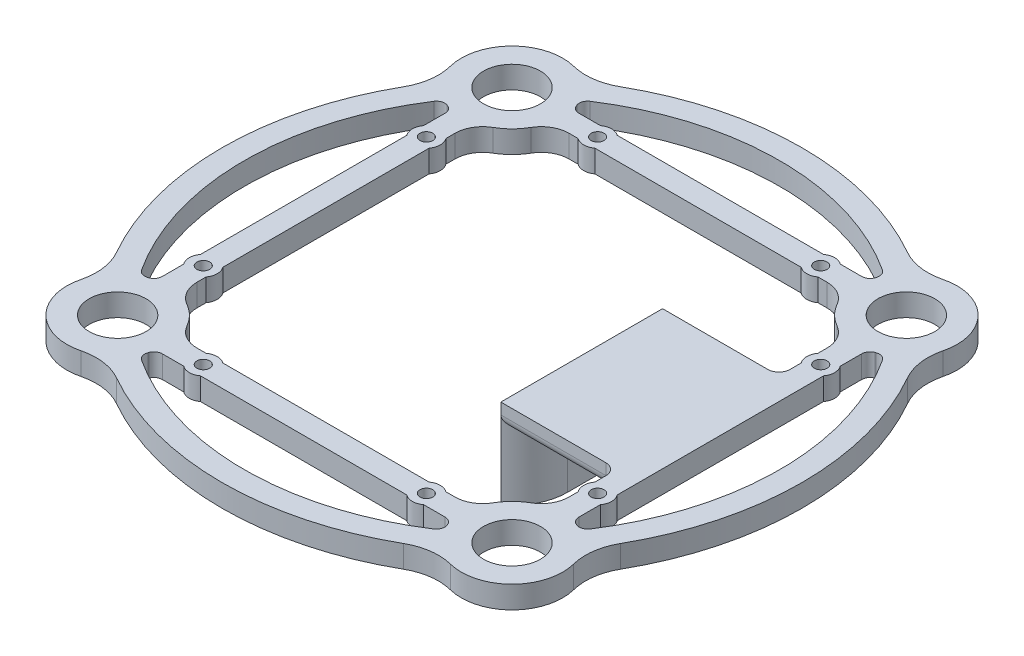
from build123d import *

# Parameters (mm, degrees)
SKETCH1_R           = 5.1
BOSS_EXTRUDE1_DEPTH = 4
BOSS_EXTRUDE2_START = -4
BOSS_EXTRUDE2_DEPTH = 4
SKETCH3_R           = 2.5
BOSS_EXTRUDE3_DEPTH = 4
SKETCH4_R           = 1.15
CUT_EXTRUDE1_DEPTH  = 4
FILLET1_R           = 10
FILLET2_R           = 1.5
FILLET3_R           = 5
SKETCH5_W           = 20.86
SKETCH5_H           = 29
BOSS_EXTRUDE4_DEPTH = 4
SKETCH6_W           = 4
SKETCH6_H           = 29
BOSS_EXTRUDE5_DEPTH = 12
FILLET4_R           = 10
FILLET5_R           = 2


with BuildPart() as part:
    # Sketch1 → Boss-Extrude1 (new body)
    with BuildSketch(Plane(origin=(0, 0, 0), x_dir=(1, 0, 0), z_dir=(0, 1, 0))):
        with BuildLine():
            ThreePointArc((-42.589636172, 29.834927363), (-52, 0), (-42.589636172, -29.834927363))
            ThreePointArc((-42.589636172, -29.834927363), (-41.790010768, -41.790010768), (-29.834927363, -42.589636172))
            ThreePointArc((-29.834927363, -42.589636172), (0, -52), (29.834927363, -42.589636172))
            ThreePointArc((29.834927363, -42.589636172), (41.790010768, -41.790010768), (42.589636172, -29.834927363))
            ThreePointArc((42.589636172, -29.834927363), (52, 0), (42.589636172, 29.834927363))
            ThreePointArc((42.589636172, 29.834927363), (41.790010768, 41.790010768), (29.834927363, 42.589636172))
            ThreePointArc((29.834927363, 42.589636172), (0, 52), (-29.834927363, 42.589636172))
            ThreePointArc((-29.834927363, 42.589636172), (-41.790010768, 41.790010768), (-42.589636172, 29.834927363))
        make_face()
        with Locations(Location((-35.355339059, -35.355339059, 0), (0, 0, 270))):
            Circle(SKETCH1_R, mode=Mode.SUBTRACT)
        with Locations(Location((35.355339059, -35.355339059, 0), (0, 0, 270))):
            Circle(SKETCH1_R, mode=Mode.SUBTRACT)
        with BuildLine():
            ThreePointArc((-27.258640426, -39.509068859), (-28.920667351, -28.920667351), (-39.509068859, -27.258640426))
            ThreePointArc((-39.509068859, -27.258640426), (-48, 0), (-39.509068859, 27.258640426))
            ThreePointArc((-39.509068859, 27.258640426), (-28.920667351, 28.920667351), (-27.258640426, 39.509068859))
            ThreePointArc((-27.258640426, 39.509068859), (0, 48), (27.258640426, 39.509068859))
            ThreePointArc((27.258640426, 39.509068859), (28.920667351, 28.920667351), (39.509068859, 27.258640426))
            ThreePointArc((39.509068859, 27.258640426), (48, 0), (39.509068859, -27.258640426))
            ThreePointArc((39.509068859, -27.258640426), (28.920667351, -28.920667351), (27.258640426, -39.509068859))
            ThreePointArc((27.258640426, -39.509068859), (0, -48), (-27.258640426, -39.509068859))
        make_face(mode=Mode.SUBTRACT)
        with Locations(Location((-35.355339059, 35.355339059, 0), (0, 0, 270))):
            Circle(SKETCH1_R, mode=Mode.SUBTRACT)
        with Locations(Location((35.355339059, 35.355339059, 0), (0, 0, 270))):
            Circle(SKETCH1_R, mode=Mode.SUBTRACT)
    extrude(amount=BOSS_EXTRUDE1_DEPTH)

    # Sketch2 → Boss-Extrude2 (add)
    with BuildSketch(Plane(origin=(0, 4, 0), x_dir=(1, 0, 0), z_dir=(0, 1, 0)).offset(BOSS_EXTRUDE2_START)):
        with BuildLine():
            ThreePointArc((-26.255339059, 35.355339059), (-26.311135203, 34.349169788), (-26.477839411, 33.355339059))
            Line((-26.477839411, 33.355339059), (26.477839411, 33.355339059))
            ThreePointArc((26.477839411, 33.355339059), (26.255339059, 35.355339059), (26.477839411, 37.355339059))
            Line((26.477839411, 37.355339059), (-26.477839411, 37.355339059))
            ThreePointArc((-26.477839411, 37.355339059), (-26.311135203, 36.36150833), (-26.255339059, 35.355339059))
        make_face()
        with BuildLine():
            Line((-33.355339059, -26.477839411), (-33.355339059, 26.477839411))
            ThreePointArc((-33.355339059, 26.477839411), (-35.355339059, 26.255339059), (-37.355339059, 26.477839411))
            Line((-37.355339059, 26.477839411), (-37.355339059, -26.477839411))
            ThreePointArc((-37.355339059, -26.477839411), (-35.355339059, -26.255339059), (-33.355339059, -26.477839411))
        make_face()
        with BuildLine():
            ThreePointArc((37.355339059, 26.477839411), (35.355339059, 26.255339059), (33.355339059, 26.477839411))
            Line((33.355339059, 26.477839411), (33.355339059, -26.477839411))
            ThreePointArc((33.355339059, -26.477839411), (35.355339059, -26.255339059), (37.355339059, -26.477839411))
            Line((37.355339059, -26.477839411), (37.355339059, 26.477839411))
        make_face()
        with BuildLine():
            Line((26.477839411, -33.355339059), (-26.477839411, -33.355339059))
            ThreePointArc((-26.477839411, -33.355339059), (-26.311135203, -34.349169788), (-26.255339059, -35.355339059))
            ThreePointArc((-26.255339059, -35.355339059), (-26.311135203, -36.36150833), (-26.477839411, -37.355339059))
            Line((-26.477839411, -37.355339059), (26.477839411, -37.355339059))
            ThreePointArc((26.477839411, -37.355339059), (26.255339059, -35.355339059), (26.477839411, -33.355339059))
        make_face()
    extrude(amount=BOSS_EXTRUDE2_DEPTH)

    # Sketch3 → Boss-Extrude3 (add)
    with BuildSketch(Plane(origin=(0, 4, 0), x_dir=(1, 0, 0), z_dir=(0, 1, 0))):
        with Locations((-20, 35.355339059)):
            Circle(SKETCH3_R)
        with Locations((20, 35.355339059)):
            Circle(SKETCH3_R)
        with Locations((35.355339059, 20)):
            Circle(SKETCH3_R)
        with Locations((35.355339059, -20)):
            Circle(SKETCH3_R)
        with Locations((-35.355339059, -20)):
            Circle(SKETCH3_R)
        with Locations((-35.355339059, 20)):
            Circle(SKETCH3_R)
        with Locations((-20, -35.355339059)):
            Circle(SKETCH3_R)
        with Locations((20, -35.355339059)):
            Circle(SKETCH3_R)
    extrude(amount=-BOSS_EXTRUDE3_DEPTH)

    # Sketch4 → Cut-Extrude1 (cut)
    with BuildSketch(Plane(origin=(0, 4, 0), x_dir=(1, 0, 0), z_dir=(0, 1, 0))):
        with Locations(Location((-20, 35.355339059, 0), (0, 0, 270))):
            Circle(SKETCH4_R)
        with Locations(Location((20, 35.355339059, 0), (0, 0, 270))):
            Circle(SKETCH4_R)
        with Locations(Location((-35.355339059, 20, 0), (0, 0, 270))):
            Circle(SKETCH4_R)
        with Locations(Location((-35.355339059, -20, 0), (0, 0, 270))):
            Circle(SKETCH4_R)
        with Locations(Location((-20, -35.355339059, 0), (0, 0, 270))):
            Circle(SKETCH4_R)
        with Locations(Location((20, -35.355339059, 0), (0, 0, 270))):
            Circle(SKETCH4_R)
        with Locations(Location((35.355339059, -20, 0), (0, 0, 270))):
            Circle(SKETCH4_R)
        with Locations(Location((35.355339059, 20, 0), (0, 0, 270))):
            Circle(SKETCH4_R)
    extrude(amount=-CUT_EXTRUDE1_DEPTH, mode=Mode.SUBTRACT)

    # Fillet1
    fillet1_edges = [part.edges().sort_by_distance(p)[0] for p in [
        (-42.589636172, 2, 29.834927363),
        (-42.589636172, 2, -29.834927363),
        (-29.834927363, 2, -42.589636172),
        (29.834927363, 2, -42.589636172),
        (42.589636172, 2, -29.834927363),
        (42.589636172, 2, 29.834927363),
        (29.834927363, 2, 42.589636172),
        (-29.834927363, 2, 42.589636172),
    ]]
    fillet(fillet1_edges, radius=FILLET1_R)

    # Fillet2
    fillet2_edges = [part.edges().sort_by_distance(p)[0] for p in [
        (37.355339059, 2, -26.477839411),
        (37.355339059, 2, 26.477839411),
        (-26.477839411, 2, 37.355339059),
        (26.477839411, 2, 37.355339059),
        (27.258640426, 2, 39.509068859),
        (39.509068859, 2, 27.258640426),
        (39.509068859, 2, -27.258640426),
        (27.258640426, 2, -39.509068859),
        (-27.258640426, 2, -39.509068859),
        (-39.509068859, 2, -27.258640426),
        (-39.509068859, 2, 27.258640426),
        (-27.258640426, 2, 39.509068859),
        (-26.477839411, 2, -37.355339059),
        (26.477839411, 2, -37.355339059),
        (-37.355339059, 2, -26.477839411),
        (-37.355339059, 2, 26.477839411),
    ]]
    fillet(fillet2_edges, radius=FILLET2_R)

    # Fillet3
    fillet3_edges = [part.edges().sort_by_distance(p)[0] for p in [
        (33.355339059, 2, -26.477839411),
        (33.355339059, 2, 26.477839411),
        (-26.477839411, 2, 33.355339059),
        (26.477839411, 2, 33.355339059),
        (-26.477839411, 2, -33.355339059),
        (26.477839411, 2, -33.355339059),
        (-33.355339059, 2, -26.477839411),
        (-33.355339059, 2, 26.477839411),
    ]]
    fillet(fillet3_edges, radius=FILLET3_R)

    # Sketch5 → Boss-Extrude4 (add)
    with BuildSketch(Plane(origin=(0, 4, 0), x_dir=(1, 0, 0), z_dir=(0, 1, 0))):
        with Locations((22.925339059, 0)):
            Rectangle(SKETCH5_W, SKETCH5_H)
    extrude(amount=-BOSS_EXTRUDE4_DEPTH)

    # Sketch6 → Boss-Extrude5 (add)
    with BuildSketch(Plane.XZ):
        with Locations((14.495339059, 0)):
            Rectangle(SKETCH6_W, SKETCH6_H)
    extrude(amount=BOSS_EXTRUDE5_DEPTH)

    # Fillet4
    # the kernel refuses this fillet: 10 mm, written as the material it takes off along each edge
    with BuildSketch(Plane(origin=(16.495339059, 0, -14.5), x_dir=(-1, 0, 0), z_dir=(0, -1, 0))) as fillet4_piece_1:
        with BuildLine():
            CenterArc((10, -8), FILLET4_R, 126.869897646, 53.130102354)
            Line((0, -8), (0, 0))
            Line((0, 0), (4, 0))
        make_face()
    extrude(amount=32, mode=Mode.SUBTRACT)
    with BuildSketch(Plane(origin=(16.495339059, 0, 14.5), x_dir=(0, 0, -1), z_dir=(0, -1, 0))) as fillet4_piece_2:
        with BuildLine():
            CenterArc((8, -10), FILLET4_R, 90, 53.130102354)
            Line((0, -4), (0, 0))
            Line((0, 0), (8, 0))
        make_face()
    extrude(amount=32, mode=Mode.SUBTRACT)

    # Fillet5
    fillet5_edges = [part.edges().sort_by_distance(p)[0] for p in [
        (33.355339059, 0, 16.5),
        (33.355339059, 2, -14.5),
        (33.355339059, 2, 14.5),
        (22.925339059, 0, -14.5),
        (22.925339059, 0, 14.5),
        (33.355339059, 0, -16.5),
    ]]
    fillet(fillet5_edges, radius=FILLET5_R)


solid = part.part
